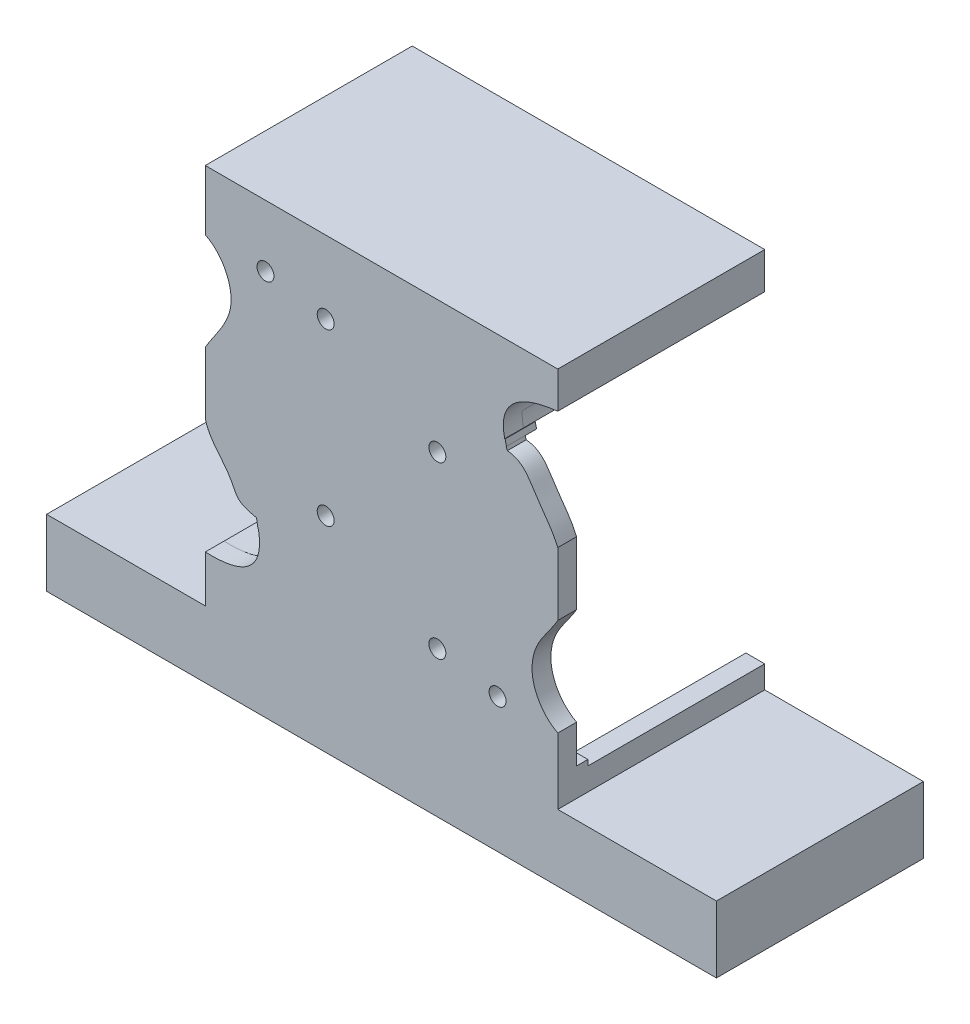
from build123d import *

# Parameters (mm, degrees)
SKETCH1_R            = 2.25
BOSS_EXTRUDE1_DEPTH  = 5
SKETCH7_R            = 2
CUT_EXTRUDE1_DEPTH   = 10
SKETCH10_W           = 93.677769422
SKETCH10_H           = 89.648680449
CUT_EXTRUDE4_DEPTH   = 10
LPATTERN1_COUNT      = 2
LPATTERN1_PITCH      = 144.65
SKETCH13_W           = 93.677769422
SKETCH13_H           = 54.298680449
BOSS_EXTRUDE2_DEPTH  = 5
SKETCH18_W           = 93.677769422
SKETCH18_H           = 5
BOSS_EXTRUDE5_DEPTH  = 5
BOSS_EXTRUDE7_DEPTH  = 8
SKETCH19_W           = 93.677769422
SKETCH19_H           = 5
BOSS_EXTRUDE8_DEPTH  = 47
SKETCH21_W           = 93.677769422
SKETCH21_H           = 5
BOSS_EXTRUDE9_DEPTH  = 3
BOSS_EXTRUDE10_DEPTH = 50
CUT_EXTRUDE5_REACH   = 289.015
FILLET1_R            = 10
SKETCH25_W           = 93.677769422
SKETCH25_H           = 185.51612098
CUT_EXTRUDE7_DEPTH   = 55
SKETCH26_W           = 5
SKETCH26_H           = 17.72
BOSS_EXTRUDE11_DEPTH = 42.16
BOSS_EXTRUDE12_DEPTH = 50


# Read off the part's stored shape, not the designer's step: Boss-Extrude10
with BuildPart() as part:
    # Sketch1 → Boss-Extrude1 (new body)
    with BuildSketch(Plane.XY):
        with BuildLine():
            Line((0, 110), (-46.838884711, 110))
            Line((-46.838884711, 110), (-46.838884711, 100.421650596))
            add(Edge.make_bspline(
                [(-46.838884711, 100.421650596), (-42.226362844, 98.141206473), (-36.711667831, 86.910333368), (-44.527260711, 78.55539065), (-46.838884711, 74.520163403)],
                knots=[0, 0, 0, 0, 0.5133871, 0.998542736, 0.998542736, 0.998542736, 0.998542736], degree=3))
            Line((-46.838884711, 74.520163403), (-46.838884711, 58.109446399))
            add(Edge.make_bspline(
                [(-46.838884711, 58.109446399), (-45.758632516, 53.655222634), (-40.885867203, 50.40646242), (-38.238529072, 43.136574556), (-34.782140744, 42.431604419), (-33.266055192, 42.106985538)],
                knots=[0, 0, 0, 0, 0.587735064, 0.769686025, 1, 1, 1, 1], degree=3))
            add(Edge.make_bspline(
                [(-33.266055192, 42.106985538), (-28.892413212, 26.709459558), (-46.838884711, 27.412777151)],
                knots=[0, 0, 0, 1, 1, 1], degree=2))
            Line((-46.838884711, 27.412777151), (-46.838884711, 7.421650596))
            add(Edge.make_bspline(
                [(-46.838884711, 7.421650596), (-42.226362844, 5.141206473), (-36.711667831, -6.089666632), (-44.527260711, -14.44460935), (-46.838884711, -18.479836597)],
                knots=[0, 0, 0, 0, 0.5133871, 0.998542736, 0.998542736, 0.998542736, 0.998542736], degree=3))
            Line((-46.838884711, -18.479836597), (-46.838884711, -34.890553601))
            add(Edge.make_bspline(
                [(-46.838884711, -34.890553601), (-45.758632516, -39.344777366), (-40.885867203, -42.59353758), (-38.238529072, -49.863425444), (-34.782140744, -50.568395581), (-33.266055192, -50.893014462)],
                knots=[0, 0, 0, 0, 0.587735064, 0.769686025, 1, 1, 1, 1], degree=3))
            add(Edge.make_bspline(
                [(-33.266055192, -50.893014462), (-28.892413212, -66.290540442), (-46.838884711, -65.587222849)],
                knots=[0, 0, 0, 1, 1, 1], degree=2))
            Line((-46.838884711, -65.587222849), (-46.838884711, -70))
            Line((-46.838884711, -70), (0, -70))
            Line((0, -70), (46.838884711, -70))
            Line((46.838884711, -70), (46.838884711, -60.421650596))
            add(Edge.make_bspline(
                [(46.838884711, -60.421650596), (42.982832164, -58.395834606), (38.906182163, -51.871311027), (41.138601483, -41.632996987), (45.188996373, -37.461060264), (46.838884711, -34.520947075)],
                knots=[0, 0, 0, 0, 0.434931401, 0.661677592, 0.998582109, 0.998582109, 0.998582109, 0.998582109], degree=3))
            Line((46.838884711, -34.520947075), (46.838884711, -17.744628899))
            add(Edge.make_bspline(
                [(46.838884711, -17.744628899), (45.396033977, -14.277729688), (40.758990778, -9.004665614), (37.573327769, -2.447994476), (33.443642317, -2.141285146)],
                knots=[0, 0, 0, 0, 0.525454982, 1, 1, 1, 1], degree=3))
            add(Edge.make_bspline(
                [(33.443642317, -2.141285146), (28.416523532, 11.559488336), (46.838884711, 13.634393344)],
                knots=[0, 0, 0, 1, 1, 1], degree=2))
            Line((46.838884711, 13.634393344), (46.838884711, 32.578349404))
            add(Edge.make_bspline(
                [(46.838884711, 32.578349404), (42.982832164, 34.604165394), (38.906182163, 41.128688973), (41.138601483, 51.367003013), (45.188996373, 55.538939736), (46.838884711, 58.479052925)],
                knots=[0, 0, 0, 0, 0.434931401, 0.661677592, 0.998582109, 0.998582109, 0.998582109, 0.998582109], degree=3))
            Line((46.838884711, 58.479052925), (46.838884711, 75.255371101))
            add(Edge.make_bspline(
                [(46.838884711, 75.255371101), (45.396033977, 78.722270312), (40.758990778, 83.995334386), (37.573327769, 90.552005524), (33.443642317, 90.858714854)],
                knots=[0, 0, 0, 0, 0.525454982, 1, 1, 1, 1], degree=3))
            Line((33.443642317, 90.858714854), (0, 110))
        make_face()
        with Locations((-14.838884711, -41.25)):
            Circle(SKETCH1_R, mode=Mode.SUBTRACT)
        with Locations((-30.838884711, 7)):
            Circle(SKETCH1_R, mode=Mode.SUBTRACT)
        with Locations((-14.838884711, 4)):
            Circle(SKETCH1_R, mode=Mode.SUBTRACT)
        with Locations((14.838884711, -57)):
            Circle(SKETCH1_R, mode=Mode.SUBTRACT)
        with Locations((30.838884711, -60)):
            Circle(SKETCH1_R, mode=Mode.SUBTRACT)
        with Locations((14.838884711, -11.75)):
            Circle(SKETCH1_R, mode=Mode.SUBTRACT)
        with Locations((-14.838884711, 51.75)):
            Circle(SKETCH1_R, mode=Mode.SUBTRACT)
        with Locations((-30.838884711, 100)):
            Circle(SKETCH1_R, mode=Mode.SUBTRACT)
        with Locations((-14.838884711, 97)):
            Circle(SKETCH1_R, mode=Mode.SUBTRACT)
        with Locations((14.838884711, 36)):
            Circle(SKETCH1_R, mode=Mode.SUBTRACT)
        with Locations((30.838884711, 33)):
            Circle(SKETCH1_R, mode=Mode.SUBTRACT)
        with Locations((14.838884711, 81.25)):
            Circle(SKETCH1_R, mode=Mode.SUBTRACT)
    extrude(amount=BOSS_EXTRUDE1_DEPTH)

    # Sketch7 → Cut-Extrude1 (cut)
    with BuildSketch(Plane.XY.offset(5)):
        with Locations((-41.838884711, 23.5)):
            Circle(SKETCH7_R)
        with Locations((-41.838884711, 67)):
            Circle(SKETCH7_R)
        with Locations((40.861115289, 67)):
            Circle(SKETCH7_R)
        with Locations((40.861115289, 23.5)):
            Circle(SKETCH7_R)
    extrude(amount=-CUT_EXTRUDE1_DEPTH, mode=Mode.SUBTRACT)

    # Sketch10 → Cut-Extrude4 (cut)
    with BuildSketch(Plane.XY.offset(5)):
        with Locations((0, 65.175659775)):
            Rectangle(SKETCH10_W, SKETCH10_H)
    extrude(amount=-CUT_EXTRUDE4_DEPTH, mode=Mode.SUBTRACT)


with BuildPart() as lpattern1_1:
    # LPattern1: pattern copy
    add(part.part.moved(Location(Vector(0, -1, 0) * (1 * LPATTERN1_PITCH))))


with BuildPart() as part_1:
    add(part.part)

    add(lpattern1_1.part)  # Boss-Extrude2 merges LPattern1_1
    # Sketch13 → Boss-Extrude2 (add)
    with BuildSketch(Plane.XY.offset(5)):
        with Locations((0, -97.149340225)):
            Rectangle(SKETCH13_W, SKETCH13_H)
    extrude(amount=-BOSS_EXTRUDE2_DEPTH)

    # Sketch18 → Boss-Extrude5 (add)
    with BuildSketch(Plane.XY.offset(5)):
        with Locations((0, -217.15)):
            Rectangle(SKETCH18_W, SKETCH18_H)
    extrude(amount=-BOSS_EXTRUDE5_DEPTH)

    # Sketch17 → Boss-Extrude7 (add)
    with BuildSketch(Plane.XY.offset(5)):
        Polygon((33.137486483, -1.25), (4.338884711, -1.25), (4.338884711, -70.5), (46.838884711, -70.5), (46.838884711, -72), (2.838884711, -72), (2.838884711, 0.25), (32.841973097, 0.25), (33.225056852, -1.25), align=None)
        Polygon((-33.036788629, -51.75), (-4.338884711, -51.75), (-4.338884711, 17.5), (-46.838884711, 17.5), (-46.838884711, 19), (-2.838884711, 19), (-2.838884711, -53.25), (-32.814550412, -53.25), (-33.107034097, -51.75), align=None)
        Polygon((-33.036788629, -196.4), (-4.338884711, -196.4), (-4.338884711, -127.15), (-46.838884711, -127.15), (-46.838884711, -125.65), (-2.838884711, -125.65), (-2.838884711, -197.9), (-32.814550412, -197.9), (-33.107034097, -196.4), align=None)
        Polygon((33.137486483, -145.9), (4.338884711, -145.9), (4.338884711, -215.15), (46.838884711, -215.15), (46.838884711, -216.65), (2.838884711, -216.65), (2.838884711, -144.4), (32.841973097, -144.4), (33.225056852, -145.9), align=None)
    extrude(amount=-BOSS_EXTRUDE7_DEPTH)

    # Sketch19 → Boss-Extrude8 (add)
    with BuildSketch(Plane.XZ.offset(219.65)):
        with Locations((0, 2.5)):
            Rectangle(SKETCH19_W, SKETCH19_H)
    extrude(amount=BOSS_EXTRUDE8_DEPTH)

    # Sketch21 → Boss-Extrude9 (add)
    with BuildSketch(Plane(origin=(0, 20.351319551, 0), x_dir=(1, 0, 0), z_dir=(0, 1, 0))):
        with Locations((0, -2.5)):
            Rectangle(SKETCH21_W, SKETCH21_H)
    extrude(amount=BOSS_EXTRUDE9_DEPTH)

    # Boss-Extrude10 outline → Boss-Extrude10 (add)
    with BuildSketch(Plane(origin=(0, 0, 0), x_dir=(-1, 0, 0), z_dir=(0, 0, -1))):
        with BuildLine():
            add(Edge.make_bspline(
                [(-32.724261898, 0.25), (-32.245095706, 2.312784936), (-32.402626668, 4.067426464)],
                knots=[0, 0, 0, 0.181136716, 0.181136716, 0.181136716], degree=2))
            Line((-32.724261898, 0.25), (-27.443994886, 0.25))
            Line((-27.443994886, 0.25), (-27.443994886, 4.733336658))
            add(Edge.make_bspline(
                [(-27.443994886, 4.733336658), (-27.622087216, 6.424627618), (-28.62420051, 9.790004967), (-31.441552833, 13.106082614), (-34.237499241, 15.062797915), (-36.55480341, 16.241237453), (-38.657870419, 17.017473528), (-40.436527292, 17.53229138), (-41.373204052, 17.759709119), (-41.838884711, 17.863154596)],
                knots=[0.188508433, 0.188508433, 0.188508433, 0.188508433, 0.359878628, 0.531248824, 0.616933921, 0.702619019, 0.788304117, 0.831146666, 0.873989214, 0.873989214, 0.873989214, 0.873989214], degree=3))
            Line((-41.838884711, 17.863154596), (-41.838884711, 19))
            Line((-41.838884711, 19), (46.838884711, 19))
            Line((46.838884711, 19), (46.838884711, 23.351319551))
            Line((46.838884711, 23.351319551), (-46.838884711, 23.351319551))
            Line((-46.838884711, 23.351319551), (-46.838884711, 13.634393344))
            add(Edge.make_bspline(
                [(-32.402626668, 4.067426464), (-33.094751911, 12.086395793), (-46.838884711, 13.634393344)],
                knots=[0.25394293, 0.25394293, 0.25394293, 1, 1, 1], degree=2))
        make_face()
        with BuildLine():
            add(Edge.make_bspline(
                [(32.709776931, -53.25), (31.734780647, -58.560461643), (33.920713563, -61.590754477)],
                knots=[0.079873384, 0.079873384, 0.079873384, 0.456195017, 0.456195017, 0.456195017], degree=2))
            Line((32.709776931, -53.25), (27.672993194, -53.25))
            add(Edge.make_bspline(
                [(27.672993194, -53.25), (27.634044039, -53.603919753), (27.549470722, -54.53429273), (27.478130031, -56.55603599), (27.696443256, -59.281114668), (28.584970164, -62.41153087), (30.219766888, -65.27653857), (32.567186832, -67.613698936), (35.393773129, -69.256198214), (37.979457465, -70.085815151), (40.144646291, -70.485795849), (41.276481585, -70.607362141), (41.838884711, -70.649060215)],
                knots=[0.020227728, 0.020227728, 0.020227728, 0.020227728, 0.052559154, 0.105118307, 0.210236615, 0.315354922, 0.42047323, 0.525591537, 0.630709845, 0.735828152, 0.788387306, 0.840946459, 0.840946459, 0.840946459, 0.840946459], degree=3))
            Line((41.838884711, -70.649060215), (46.838884711, -70.649060215))
            Line((46.838884711, -70.649060215), (46.838884711, -65.587222848))
            add(Edge.make_bspline(
                [(33.920713563, -61.590754477), (36.999202525, -66.479878046), (46.838884711, -65.587222848)],
                knots=[0.383965009, 0.383965009, 0.383965009, 1, 1, 1], degree=2))
        make_face()
        with BuildLine():
            add(Edge.make_bspline(
                [(-32.724261899, -144.4), (-32.245095735, -142.337215187), (-32.40262665, -140.582573745)],
                knots=[0, 0, 0, 0.181136705, 0.181136705, 0.181136705], degree=2))
            Line((-32.724261899, -144.4), (-27.624350546, -144.4))
            add(Edge.make_bspline(
                [(-27.624350546, -144.4), (-27.502918691, -143.696257513), (-27.293028635, -141.891316279), (-27.435749972, -139.015823853), (-28.37747966, -135.845139515), (-30.113029915, -133.024976386), (-32.462833621, -130.741878365), (-35.232498366, -128.995170141), (-37.82646734, -127.905854752), (-40.056119375, -127.214276507), (-41.247409264, -126.918228045), (-41.838884711, -126.786845404)],
                knots=[0.038284513, 0.038284513, 0.038284513, 0.038284513, 0.109248652, 0.218497304, 0.327745955, 0.436994607, 0.546243259, 0.655491911, 0.764740563, 0.819364888, 0.873989214, 0.873989214, 0.873989214, 0.873989214], degree=3))
            Line((-41.838884711, -126.786845404), (-46.838884711, -126.786845404))
            Line((-46.838884711, -126.786845404), (-46.838884711, -131.015606656))
            add(Edge.make_bspline(
                [(-32.40262665, -140.582573745), (-33.094751732, -132.563604227), (-46.838884711, -131.015606656)],
                knots=[0.25394292, 0.25394292, 0.25394292, 1, 1, 1], degree=2))
        make_face()
        with BuildLine():
            add(Edge.make_bspline(
                [(32.709776931, -197.9), (31.734780645, -203.210461655), (33.920713573, -206.240754491)],
                knots=[0.079873384, 0.079873384, 0.079873384, 0.456195018, 0.456195018, 0.456195018], degree=2))
            Line((32.709776931, -197.9), (27.672993196, -197.9))
            add(Edge.make_bspline(
                [(27.672993196, -197.9), (27.63404404, -198.253919753), (27.549470724, -199.184292729), (27.478130032, -201.206035989), (27.696443257, -203.931114667), (28.584970165, -207.061530869), (30.219766889, -209.926538569), (32.567186833, -212.263698936), (35.393773129, -213.906198214), (37.979457465, -214.73581515), (40.144646291, -215.135795849), (41.276481585, -215.25736214), (41.838884711, -215.299060215)],
                knots=[0.020227728, 0.020227728, 0.020227728, 0.020227728, 0.052559154, 0.105118307, 0.210236615, 0.315354922, 0.42047323, 0.525591537, 0.630709845, 0.735828152, 0.788387306, 0.84094646, 0.84094646, 0.84094646, 0.84094646], degree=3))
            Line((41.838884711, -215.299060215), (41.838884711, -261.65))
            Line((41.838884711, -261.65), (-41.838884711, -261.65))
            Line((-41.838884711, -261.65), (-41.838884711, -216.65))
            Line((-41.838884711, -216.65), (-46.838884711, -216.65))
            Line((-46.838884711, -216.65), (-46.838884711, -266.65))
            Line((-46.838884711, -266.65), (46.838884711, -266.65))
            Line((46.838884711, -266.65), (46.838884711, -210.237222849))
            add(Edge.make_bspline(
                [(33.920713573, -206.240754491), (36.999202539, -211.129878044), (46.838884711, -210.237222849)],
                knots=[0.38396501, 0.38396501, 0.38396501, 1, 1, 1], degree=2))
        make_face()
    extrude(amount=BOSS_EXTRUDE10_DEPTH)

    # Cut-Extrude5: up to this face of the body (flat: up to its plane)
    cut_extrude5_end = Plane(part_1.part.faces().sort_by_distance((46.838884711, -170.782787987, 2.5))[0])
    # Sketch24 → Cut-Extrude5 (cut, up to the picked face)
    with BuildSketch(Plane.ZY.offset(46.838884711), mode=Mode.PRIVATE) as cut_extrude5_sk1:
        Polygon((-50, -266.65), (5, -256.952016061), (5, -266.65), align=None)
    cut_extrude5_tool1 = split(extrude(cut_extrude5_sk1.sketch, amount=-CUT_EXTRUDE5_REACH, mode=Mode.PRIVATE), bisect_by=cut_extrude5_end, keep=Keep.BOTH, mode=Mode.PRIVATE)
    add(cut_extrude5_tool1.solids().sort_by(Axis((-46.838885, -263.417339, -13.333333), (1, 0, 0)))[0], mode=Mode.SUBTRACT)

    # Fillet1
    # the kernel refuses this fillet: 10 mm, written as the material it takes off along each edge
    with BuildSketch(Plane(origin=(46.838884711, -270.991204442, -74.620193825), x_dir=(0, 0.9848077530122092, -0.17364817766692375), z_dir=(0, 0.17364817766692378, 0.9848077530122094)), Plane(origin=(-46.838884711, -270.991204442, -74.620193825), x_dir=(1, 0, 0), z_dir=(0, 0.17364817766692378, 0.9848077530122094))) as fillet1_piece_1:
        with BuildLine():
            CenterArc((FILLET1_R, FILLET1_R), FILLET1_R, 180, 90)
            Line((0, FILLET1_R), (0, 0))
            Line((0, 0), (FILLET1_R, 0))
        make_face()
    extrude(amount=105.848463654, mode=Mode.SUBTRACT)

    # Sketch25 → Cut-Extrude7 (cut)
    with BuildSketch(Plane.XY.offset(5)):
        with Locations((0, -188.476689117)):
            Rectangle(SKETCH25_W, SKETCH25_H)
    extrude(amount=-CUT_EXTRUDE7_DEPTH, mode=Mode.SUBTRACT)

    # Sketch26 → Boss-Extrude11 (add)
    with BuildSketch(Plane(origin=(46.838884711, 0, 0), x_dir=(0, 0, -1), z_dir=(1, 0, 0))):
        with Locations((-2.5, -86.858628627)):
            Rectangle(SKETCH26_W, SKETCH26_H)
    boss_extrude11 = extrude(amount=BOSS_EXTRUDE11_DEPTH)

    # Mirror1: Boss-Extrude11 across plane
    add(boss_extrude11.mirror(Plane(origin=(0, 0, 0), x_dir=(0, 0, 1), z_dir=(1, 0, 0))))

    # Sketch27 → Boss-Extrude12 (add)
    with BuildSketch(Plane(origin=(0, 0, 0), x_dir=(-1, 0, 0), z_dir=(0, 0, -1))):
        Polygon((46.838884711, -70.649060215), (46.838884711, -77.998628627), (88.998884711, -77.998628627), (88.998884711, -95.718628627), (83.998884711, -95.718628627), (83.998884711, -90.718628627), (83.998884711, -82.998628627), (41.838884711, -82.998628627), (41.838884711, -70.649060215), align=None)
        Polygon((-88.998884711, -95.718628627), (-88.998884711, -77.998628627), (-46.838884711, -77.998628627), (-46.838884711, -72), (-41.838884711, -72), (-41.838884711, -82.998628627), (-83.998884711, -82.998628627), (-83.998884711, -90.718628627), (-83.998884711, -95.718628627), align=None)
    extrude(amount=BOSS_EXTRUDE12_DEPTH)


solid = part_1.part
